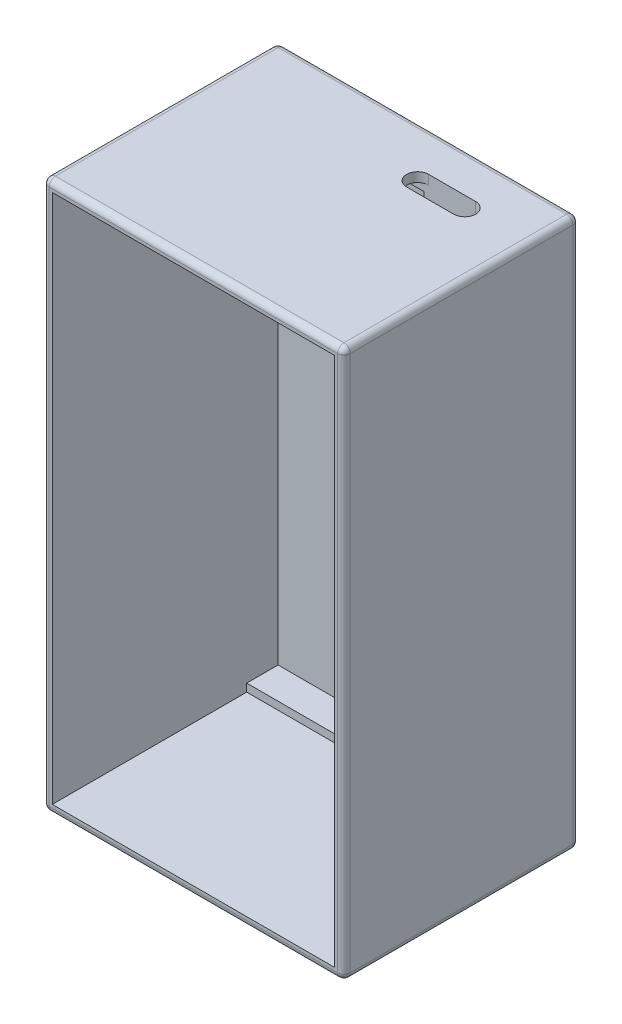
from build123d import *

# Parameters (mm, degrees)
SKETCH1_W           = 96
SKETCH1_H           = 175
BOSS_EXTRUDE1_DEPTH = 100
SKETCH2_W           = 90
SKETCH2_H           = 169
CUT_EXTRUDE1_DEPTH  = 87
SKETCH3_W           = 56.5
SKETCH3_H           = 164
CUT_EXTRUDE2_DEPTH  = 10
SKETCH5_R           = 6
CUT_EXTRUDE3_DEPTH  = 10
SKETCH6_W           = 33.5
SKETCH6_H           = 48
CUT_EXTRUDE4_DEPTH  = 10
CUT_EXTRUDE6_DEPTH  = 10
SKETCH10_W          = 96
SKETCH10_H          = 25
CUT_EXTRUDE8_DEPTH  = 200
FILLET1_R           = 2
SKETCH11_R          = 2.5
CUT_EXTRUDE9_DEPTH  = 5


with BuildPart() as part:
    # Sketch1 → Boss-Extrude1 (new body)
    with BuildSketch(Plane.XY):
        Rectangle(SKETCH1_W, SKETCH1_H)
    extrude(amount=BOSS_EXTRUDE1_DEPTH)

    # Sketch2 → Cut-Extrude1 (cut)
    with BuildSketch(Plane.XY.offset(100)):
        Rectangle(SKETCH2_W, SKETCH2_H)
    extrude(amount=-CUT_EXTRUDE1_DEPTH, mode=Mode.SUBTRACT)

    # Sketch3 → Cut-Extrude2 (cut)
    with BuildSketch(Plane.XY.offset(13)):
        with Locations((-16.75, 0)):
            Rectangle(SKETCH3_W, SKETCH3_H)
    extrude(amount=-CUT_EXTRUDE2_DEPTH, mode=Mode.SUBTRACT)

    # Sketch5 → Cut-Extrude3 (cut)
    with BuildSketch(Plane(origin=(0, -84.5, 0), x_dir=(1, 0, 0), z_dir=(0, 1, 0))):
        with Locations((28.25, -23)):
            Circle(SKETCH5_R)
    extrude(amount=-CUT_EXTRUDE3_DEPTH, mode=Mode.SUBTRACT)

    # Sketch6 → Cut-Extrude4 (cut)
    with BuildSketch(Plane.XY.offset(13)):
        with Locations((28.25, -15.5)):
            Rectangle(SKETCH6_W, SKETCH6_H)
    extrude(amount=-CUT_EXTRUDE4_DEPTH, mode=Mode.SUBTRACT)

    # Sketch9 → Cut-Extrude6 (cut)
    with BuildSketch(Plane.XZ.offset(-84.5)):
        with BuildLine():
            Line((13, 20), (28, 20))
            ThreePointArc((28, 20), (31.5, 16.5), (28, 13))
            Line((28, 13), (13, 13))
            ThreePointArc((13, 13), (9.5, 16.5), (13, 20))
        make_face()
    extrude(amount=-CUT_EXTRUDE6_DEPTH, mode=Mode.SUBTRACT)

    # Sketch10 → Cut-Extrude8 (cut)
    with BuildSketch(Plane.XZ.offset(87.5)):
        with Locations((0, 87.5)):
            Rectangle(SKETCH10_W, SKETCH10_H)
    extrude(amount=-CUT_EXTRUDE8_DEPTH, mode=Mode.SUBTRACT)

    # Fillet1
    fillet1_edges = [part.edges().sort_by_distance(p)[0] for p in [
        (0, 87.5, 0),
        (0, 87.5, 75),
        (48, 87.5, 37.5),
        (48, 0, 0),
        (48, 0, 75),
        (-48, 87.5, 37.5),
        (-48, 0, 75),
        (-48, 0, 0),
        (0, -87.5, 75),
        (48, -87.5, 37.5),
        (0, -87.5, 0),
        (-48, -87.5, 37.5),
    ]]
    fillet(fillet1_edges, radius=FILLET1_R)

    # Sketch11 → Cut-Extrude9 (cut)
    with BuildSketch(Plane.XZ.offset(87.5)):
        with Locations((0, 23)):
            Circle(SKETCH11_R)
    extrude(amount=-CUT_EXTRUDE9_DEPTH, mode=Mode.SUBTRACT)


solid = part.part
